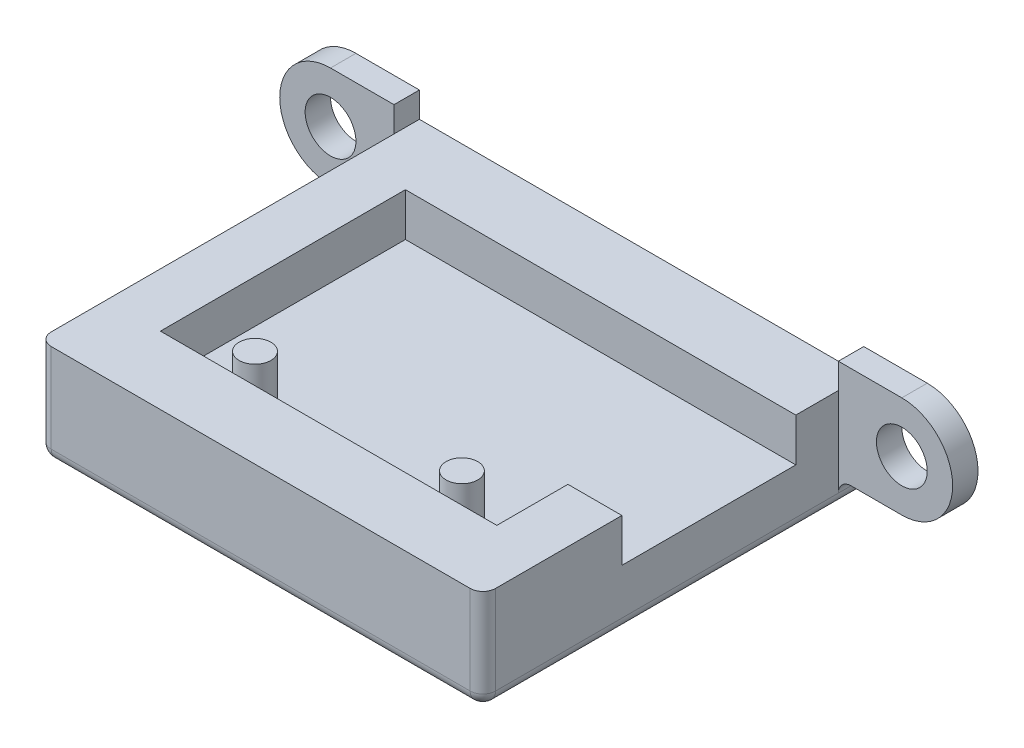
from build123d import *

# Parameters (mm, degrees)
CROQUIS1_W              = 35
CROQUIS1_H              = 30
SALIENTE_EXTRUIR1_DEPTH = 8
CROQUIS2_R              = 1.25
CORTAR_EXTRUIR2_DEPTH   = 3.4
CROQUIS3_R              = 2
SALIENTE_EXTRUIR2_DEPTH = 2
REDONDEO1_R             = 1


with BuildPart() as part:
    # Croquis1 → Saliente-Extruir1 (new body)
    with BuildSketch(Plane(origin=(0, 0, 0), x_dir=(1, 0, 0), z_dir=(0, 1, 0))):
        Rectangle(CROQUIS1_W, CROQUIS1_H)
    extrude(amount=SALIENTE_EXTRUIR1_DEPTH)

    # Croquis2 → Cortar-Extruir2 (cut)
    with BuildSketch(Plane(origin=(0, 8, 0), x_dir=(1, 0, 0), z_dir=(0, 1, 0))):
        Polygon((13.25, 9.65), (17.5, 9.65), (17.5, -4.05), (13.25, -4.05), (13.25, -9.65), (-13.25, -9.65), (-13.25, 9.65), align=None)
        with Locations(Location((-8.15, -7.3, 0), (0, 0, 270))):
            Circle(CROQUIS2_R, mode=Mode.SUBTRACT)
        with Locations(Location((8.15, -7.3, 0), (0, 0, 270))):
            Circle(CROQUIS2_R, mode=Mode.SUBTRACT)
    extrude(amount=-CORTAR_EXTRUIR2_DEPTH, mode=Mode.SUBTRACT)

    # Croquis3 → Saliente-Extruir2 (add)
    # profile 1 of 2: a face of its own
    with BuildSketch(Plane(origin=(0, 0, -15), x_dir=(-1, 0, 0), z_dir=(0, 0, -1))):
        with BuildLine():
            Line((-17.5, 2), (-17.5, 10))
            Line((-17.5, 10), (-22.5, 10))
            ThreePointArc((-22.5, 10), (-26.5, 6), (-22.5, 2))
            Line((-22.5, 2), (-17.5, 2))
        make_face()
        with Locations((-22.5, 6)):
            Circle(CROQUIS3_R, mode=Mode.SUBTRACT)
    # profile 2 of 2: a face of its own
    with BuildSketch(Plane(origin=(0, 0, -15), x_dir=(-1, 0, 0), z_dir=(0, 0, -1))):
        with BuildLine():
            Line((17.5, 10), (22.5, 10))
            ThreePointArc((22.5, 10), (26.5, 6), (22.5, 2))
            Line((22.5, 2), (17.5, 2))
            Line((17.5, 2), (17.5, 10))
        make_face()
        with Locations(Location((22.5, 6, 0), (0, 0, 180))):
            Circle(CROQUIS3_R, mode=Mode.SUBTRACT)
    extrude(amount=-SALIENTE_EXTRUIR2_DEPTH)

    # Redondeo1
    redondeo1_edges = [part.edges().sort_by_distance(p)[0] for p in [
        (17.5, 2, -14),
        (17.5, 0, 0),
        (0, 0, 15),
        (-17.5, 0, 0),
        (-17.5, 2, -14),
        (-17.5, 4, 15),
        (17.5, 4, 15),
    ]]
    fillet(redondeo1_edges, radius=REDONDEO1_R - 0.0001)  # a hair under: the kernel refuses the full size


solid = part.part
